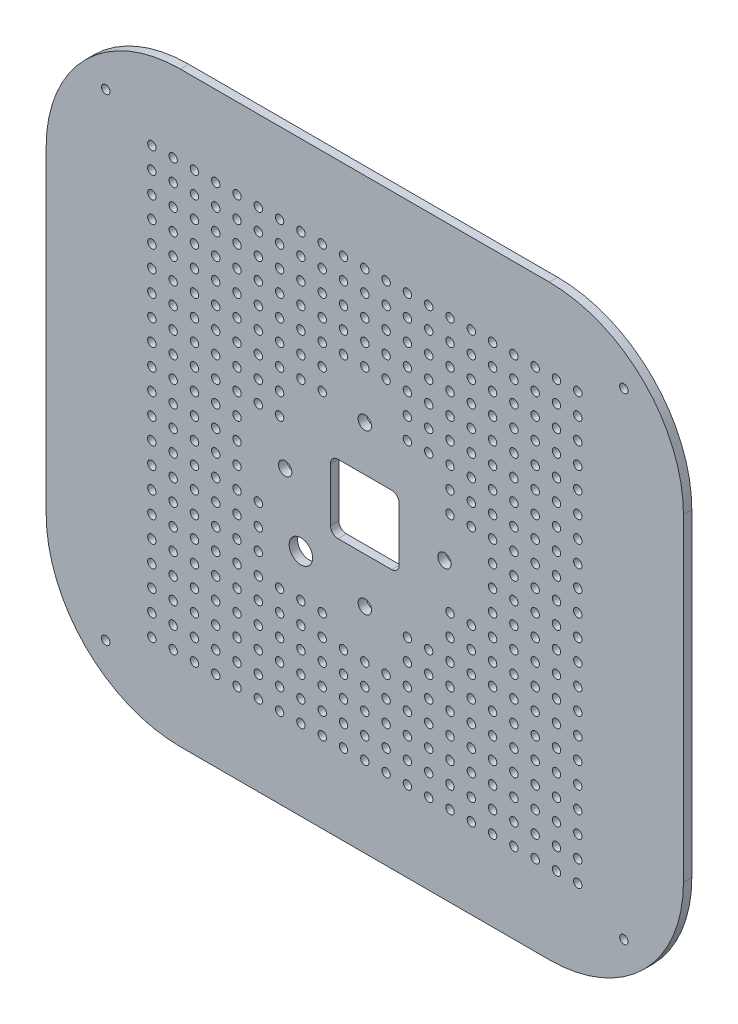
from build123d import *

# Parameters (mm, degrees)
SKETCH_1_R          = 2.5
SKETCH_1_W          = 41
SKETCH_1_H          = 41
EXTRUDE_1_DEPTH     = 5
FILLET_1_R          = 80
FILLET_3_R          = 4.5
SKETCH_2_R          = 2.5
SKETCH_2_R_2        = 4
SKETCH_2_R_3        = 7
CUT_EXTRUDE_1_DEPTH = 10


with BuildPart() as part:
    # 草图1 → 凸台-拉伸1 (new body)
    with BuildSketch(Plane.XY):
        Polygon((190, -61.256325779), (190, 88.743674221), (190, 175), (-190, 175), (-190, 88.743674221), (-190, -61.256325779), (-190, -175), (190, -175), align=None)
        with Locations((154.464472083, 142.269908498)):
            Circle(SKETCH_1_R, mode=Mode.SUBTRACT)
        with Locations((-154.464472083, 142.269908498)):
            Circle(SKETCH_1_R, mode=Mode.SUBTRACT)
        with Locations((-154.464472083, -142.269908498)):
            Circle(SKETCH_1_R, mode=Mode.SUBTRACT)
        with Locations((154.464472083, -142.269908498)):
            Circle(SKETCH_1_R, mode=Mode.SUBTRACT)
        Rectangle(SKETCH_1_W, SKETCH_1_H, mode=Mode.SUBTRACT)
    extrude(amount=EXTRUDE_1_DEPTH)

    # 圆角1
    fillet_1_edges = [part.edges().sort_by_distance(p)[0] for p in [
        (-190, -175, 2.5),
        (190, -175, 2.5),
        (-190, 175, 2.5),
        (190, 175, 2.5),
    ]]
    fillet(fillet_1_edges, radius=FILLET_1_R)

    # 圆角3
    fillet_3_edges = [part.edges().sort_by_distance(p)[0] for p in [
        (-20.5, 20.5, 2.5),
        (20.5, 20.5, 2.5),
        (20.5, -20.5, 2.5),
        (-20.5, -20.5, 2.5),
    ]]
    fillet(fillet_3_edges, radius=FILLET_3_R)

    # 草图2 → 切除-拉伸1 (cut)
    with BuildSketch(Plane.XY.offset(5)):
        with Locations((127, -127)):
            Circle(SKETCH_2_R)
        with Locations((114.3, -127)):
            Circle(SKETCH_2_R)
        with Locations((101.6, -127)):
            Circle(SKETCH_2_R)
        with Locations((88.9, -127)):
            Circle(SKETCH_2_R)
        with Locations((76.2, -127)):
            Circle(SKETCH_2_R)
        with Locations((63.5, -127)):
            Circle(SKETCH_2_R)
        with Locations((50.8, -127)):
            Circle(SKETCH_2_R)
        with Locations((38.1, -127)):
            Circle(SKETCH_2_R)
        with Locations((25.4, -127)):
            Circle(SKETCH_2_R)
        with Locations((12.7, -127)):
            Circle(SKETCH_2_R)
        with Locations((0, -127)):
            Circle(SKETCH_2_R)
        with Locations((-12.7, -127)):
            Circle(SKETCH_2_R)
        with Locations((-25.4, -127)):
            Circle(SKETCH_2_R)
        with Locations((-38.1, -127)):
            Circle(SKETCH_2_R)
        with Locations((-50.8, -127)):
            Circle(SKETCH_2_R)
        with Locations((-63.5, -127)):
            Circle(SKETCH_2_R)
        with Locations((-76.2, -127)):
            Circle(SKETCH_2_R)
        with Locations((-88.9, -127)):
            Circle(SKETCH_2_R)
        with Locations((-101.6, -127)):
            Circle(SKETCH_2_R)
        with Locations((-114.3, -127)):
            Circle(SKETCH_2_R)
        with Locations((114.3, -114.3)):
            Circle(SKETCH_2_R)
        with Locations((101.6, -114.3)):
            Circle(SKETCH_2_R)
        with Locations((88.9, -114.3)):
            Circle(SKETCH_2_R)
        with Locations((76.2, -114.3)):
            Circle(SKETCH_2_R)
        with Locations((63.5, -114.3)):
            Circle(SKETCH_2_R)
        with Locations((50.8, -114.3)):
            Circle(SKETCH_2_R)
        with Locations((38.1, -114.3)):
            Circle(SKETCH_2_R)
        with Locations((25.4, -114.3)):
            Circle(SKETCH_2_R)
        with Locations((12.7, -114.3)):
            Circle(SKETCH_2_R)
        with Locations((0, -114.3)):
            Circle(SKETCH_2_R)
        with Locations((-12.7, -114.3)):
            Circle(SKETCH_2_R)
        with Locations((-25.4, -114.3)):
            Circle(SKETCH_2_R)
        with Locations((-38.1, -114.3)):
            Circle(SKETCH_2_R)
        with Locations((-50.8, -114.3)):
            Circle(SKETCH_2_R)
        with Locations((-63.5, -114.3)):
            Circle(SKETCH_2_R)
        with Locations((-76.2, -114.3)):
            Circle(SKETCH_2_R)
        with Locations((-88.9, -114.3)):
            Circle(SKETCH_2_R)
        with Locations((-101.6, -114.3)):
            Circle(SKETCH_2_R)
        with Locations((-114.3, -114.3)):
            Circle(SKETCH_2_R)
        with Locations((114.3, -101.6)):
            Circle(SKETCH_2_R)
        with Locations((101.6, -101.6)):
            Circle(SKETCH_2_R)
        with Locations((88.9, -101.6)):
            Circle(SKETCH_2_R)
        with Locations((76.2, -101.6)):
            Circle(SKETCH_2_R)
        with Locations((63.5, -101.6)):
            Circle(SKETCH_2_R)
        with Locations((50.8, -101.6)):
            Circle(SKETCH_2_R)
        with Locations((38.1, -101.6)):
            Circle(SKETCH_2_R)
        with Locations((25.4, -101.6)):
            Circle(SKETCH_2_R)
        with Locations((12.7, -101.6)):
            Circle(SKETCH_2_R)
        with Locations((0, -101.6)):
            Circle(SKETCH_2_R)
        with Locations((-12.7, -101.6)):
            Circle(SKETCH_2_R)
        with Locations((-25.4, -101.6)):
            Circle(SKETCH_2_R)
        with Locations((-38.1, -101.6)):
            Circle(SKETCH_2_R)
        with Locations((-50.8, -101.6)):
            Circle(SKETCH_2_R)
        with Locations((-63.5, -101.6)):
            Circle(SKETCH_2_R)
        with Locations((-76.2, -101.6)):
            Circle(SKETCH_2_R)
        with Locations((-88.9, -101.6)):
            Circle(SKETCH_2_R)
        with Locations((-101.6, -101.6)):
            Circle(SKETCH_2_R)
        with Locations((-114.3, -101.6)):
            Circle(SKETCH_2_R)
        with Locations((114.3, -88.9)):
            Circle(SKETCH_2_R)
        with Locations((101.6, -88.9)):
            Circle(SKETCH_2_R)
        with Locations((88.9, -88.9)):
            Circle(SKETCH_2_R)
        with Locations((76.2, -88.9)):
            Circle(SKETCH_2_R)
        with Locations((63.5, -88.9)):
            Circle(SKETCH_2_R)
        with Locations((50.8, -88.9)):
            Circle(SKETCH_2_R)
        with Locations((38.1, -88.9)):
            Circle(SKETCH_2_R)
        with Locations((25.4, -88.9)):
            Circle(SKETCH_2_R)
        with Locations((12.7, -88.9)):
            Circle(SKETCH_2_R)
        with Locations((0, -88.9)):
            Circle(SKETCH_2_R)
        with Locations((-12.7, -88.9)):
            Circle(SKETCH_2_R)
        with Locations((-25.4, -88.9)):
            Circle(SKETCH_2_R)
        with Locations((-38.1, -88.9)):
            Circle(SKETCH_2_R)
        with Locations((-50.8, -88.9)):
            Circle(SKETCH_2_R)
        with Locations((-63.5, -88.9)):
            Circle(SKETCH_2_R)
        with Locations((-76.2, -88.9)):
            Circle(SKETCH_2_R)
        with Locations((-88.9, -88.9)):
            Circle(SKETCH_2_R)
        with Locations((-101.6, -88.9)):
            Circle(SKETCH_2_R)
        with Locations((-114.3, -88.9)):
            Circle(SKETCH_2_R)
        with Locations((114.3, -76.2)):
            Circle(SKETCH_2_R)
        with Locations((101.6, -76.2)):
            Circle(SKETCH_2_R)
        with Locations((88.9, -76.2)):
            Circle(SKETCH_2_R)
        with Locations((76.2, -76.2)):
            Circle(SKETCH_2_R)
        with Locations((63.5, -76.2)):
            Circle(SKETCH_2_R)
        with Locations((50.8, -76.2)):
            Circle(SKETCH_2_R)
        with Locations((38.1, -76.2)):
            Circle(SKETCH_2_R)
        with Locations((25.4, -76.2)):
            Circle(SKETCH_2_R)
        with Locations((12.7, -76.2)):
            Circle(SKETCH_2_R)
        with Locations((0, -76.2)):
            Circle(SKETCH_2_R)
        with Locations((-12.7, -76.2)):
            Circle(SKETCH_2_R)
        with Locations((-25.4, -76.2)):
            Circle(SKETCH_2_R)
        with Locations((-38.1, -76.2)):
            Circle(SKETCH_2_R)
        with Locations((-50.8, -76.2)):
            Circle(SKETCH_2_R)
        with Locations((-63.5, -76.2)):
            Circle(SKETCH_2_R)
        with Locations((-76.2, -76.2)):
            Circle(SKETCH_2_R)
        with Locations((-88.9, -76.2)):
            Circle(SKETCH_2_R)
        with Locations((-101.6, -76.2)):
            Circle(SKETCH_2_R)
        with Locations((-114.3, -76.2)):
            Circle(SKETCH_2_R)
        with Locations((114.3, -63.5)):
            Circle(SKETCH_2_R)
        with Locations((101.6, -63.5)):
            Circle(SKETCH_2_R)
        with Locations((88.9, -63.5)):
            Circle(SKETCH_2_R)
        with Locations((76.2, -63.5)):
            Circle(SKETCH_2_R)
        with Locations((63.5, -63.5)):
            Circle(SKETCH_2_R)
        with Locations((50.8, -63.5)):
            Circle(SKETCH_2_R)
        with Locations((38.1, -63.5)):
            Circle(SKETCH_2_R)
        with Locations((25.4, -63.5)):
            Circle(SKETCH_2_R)
        with Locations((-25.4, -63.5)):
            Circle(SKETCH_2_R)
        with Locations((-38.1, -63.5)):
            Circle(SKETCH_2_R)
        with Locations((-50.8, -63.5)):
            Circle(SKETCH_2_R)
        with Locations((-63.5, -63.5)):
            Circle(SKETCH_2_R)
        with Locations((-76.2, -63.5)):
            Circle(SKETCH_2_R)
        with Locations((-88.9, -63.5)):
            Circle(SKETCH_2_R)
        with Locations((-101.6, -63.5)):
            Circle(SKETCH_2_R)
        with Locations((-114.3, -63.5)):
            Circle(SKETCH_2_R)
        with Locations((114.3, -50.8)):
            Circle(SKETCH_2_R)
        with Locations((101.6, -50.8)):
            Circle(SKETCH_2_R)
        with Locations((88.9, -50.8)):
            Circle(SKETCH_2_R)
        with Locations((76.2, -50.8)):
            Circle(SKETCH_2_R)
        with Locations((63.5, -50.8)):
            Circle(SKETCH_2_R)
        with Locations((50.8, -50.8)):
            Circle(SKETCH_2_R)
        with Locations((38.1, -50.8)):
            Circle(SKETCH_2_R)
        with Locations((25.4, -50.8)):
            Circle(SKETCH_2_R)
        with Locations((-63.5, -50.8)):
            Circle(SKETCH_2_R)
        with Locations((-76.2, -50.8)):
            Circle(SKETCH_2_R)
        with Locations((-88.9, -50.8)):
            Circle(SKETCH_2_R)
        with Locations((-101.6, -50.8)):
            Circle(SKETCH_2_R)
        with Locations((-114.3, -50.8)):
            Circle(SKETCH_2_R)
        with Locations((114.3, -38.1)):
            Circle(SKETCH_2_R)
        with Locations((101.6, -38.1)):
            Circle(SKETCH_2_R)
        with Locations((88.9, -38.1)):
            Circle(SKETCH_2_R)
        with Locations((76.2, -38.1)):
            Circle(SKETCH_2_R)
        with Locations((63.5, -38.1)):
            Circle(SKETCH_2_R)
        with Locations((50.8, -38.1)):
            Circle(SKETCH_2_R)
        with Locations((-63.5, -38.1)):
            Circle(SKETCH_2_R)
        with Locations((-76.2, -38.1)):
            Circle(SKETCH_2_R)
        with Locations((-88.9, -38.1)):
            Circle(SKETCH_2_R)
        with Locations((-101.6, -38.1)):
            Circle(SKETCH_2_R)
        with Locations((-114.3, -38.1)):
            Circle(SKETCH_2_R)
        with Locations((114.3, -25.4)):
            Circle(SKETCH_2_R)
        with Locations((101.6, -25.4)):
            Circle(SKETCH_2_R)
        with Locations((88.9, -25.4)):
            Circle(SKETCH_2_R)
        with Locations((76.2, -25.4)):
            Circle(SKETCH_2_R)
        with Locations((63.5, -25.4)):
            Circle(SKETCH_2_R)
        with Locations((50.8, -25.4)):
            Circle(SKETCH_2_R)
        with Locations((-63.5, -25.4)):
            Circle(SKETCH_2_R)
        with Locations((-76.2, -25.4)):
            Circle(SKETCH_2_R)
        with Locations((-88.9, -25.4)):
            Circle(SKETCH_2_R)
        with Locations((-101.6, -25.4)):
            Circle(SKETCH_2_R)
        with Locations((-114.3, -25.4)):
            Circle(SKETCH_2_R)
        with Locations((114.3, -12.7)):
            Circle(SKETCH_2_R)
        with Locations((101.6, -12.7)):
            Circle(SKETCH_2_R)
        with Locations((88.9, -12.7)):
            Circle(SKETCH_2_R)
        with Locations((76.2, -12.7)):
            Circle(SKETCH_2_R)
        with Locations((-76.2, -12.7)):
            Circle(SKETCH_2_R)
        with Locations((-88.9, -12.7)):
            Circle(SKETCH_2_R)
        with Locations((-101.6, -12.7)):
            Circle(SKETCH_2_R)
        with Locations((-114.3, -12.7)):
            Circle(SKETCH_2_R)
        with Locations((114.3, 0)):
            Circle(SKETCH_2_R)
        with Locations((101.6, 0)):
            Circle(SKETCH_2_R)
        with Locations((88.9, 0)):
            Circle(SKETCH_2_R)
        with Locations((76.2, 0)):
            Circle(SKETCH_2_R)
        with Locations((-76.2, 0)):
            Circle(SKETCH_2_R)
        with Locations((-88.9, 0)):
            Circle(SKETCH_2_R)
        with Locations((-101.6, 0)):
            Circle(SKETCH_2_R)
        with Locations((-114.3, 0)):
            Circle(SKETCH_2_R)
        with Locations((114.3, 12.7)):
            Circle(SKETCH_2_R)
        with Locations((101.6, 12.7)):
            Circle(SKETCH_2_R)
        with Locations((88.9, 12.7)):
            Circle(SKETCH_2_R)
        with Locations((76.2, 12.7)):
            Circle(SKETCH_2_R)
        with Locations((-76.2, 12.7)):
            Circle(SKETCH_2_R)
        with Locations((-88.9, 12.7)):
            Circle(SKETCH_2_R)
        with Locations((-101.6, 12.7)):
            Circle(SKETCH_2_R)
        with Locations((-114.3, 12.7)):
            Circle(SKETCH_2_R)
        with Locations((114.3, 25.4)):
            Circle(SKETCH_2_R)
        with Locations((101.6, 25.4)):
            Circle(SKETCH_2_R)
        with Locations((88.9, 25.4)):
            Circle(SKETCH_2_R)
        with Locations((76.2, 25.4)):
            Circle(SKETCH_2_R)
        with Locations((63.5, 25.4)):
            Circle(SKETCH_2_R)
        with Locations((50.8, 25.4)):
            Circle(SKETCH_2_R)
        with Locations((-50.8, 25.4)):
            Circle(SKETCH_2_R)
        with Locations((-63.5, 25.4)):
            Circle(SKETCH_2_R)
        with Locations((-76.2, 25.4)):
            Circle(SKETCH_2_R)
        with Locations((-88.9, 25.4)):
            Circle(SKETCH_2_R)
        with Locations((-101.6, 25.4)):
            Circle(SKETCH_2_R)
        with Locations((-114.3, 25.4)):
            Circle(SKETCH_2_R)
        with Locations((114.3, 38.1)):
            Circle(SKETCH_2_R)
        with Locations((101.6, 38.1)):
            Circle(SKETCH_2_R)
        with Locations((88.9, 38.1)):
            Circle(SKETCH_2_R)
        with Locations((76.2, 38.1)):
            Circle(SKETCH_2_R)
        with Locations((63.5, 38.1)):
            Circle(SKETCH_2_R)
        with Locations((50.8, 38.1)):
            Circle(SKETCH_2_R)
        with Locations((-50.8, 38.1)):
            Circle(SKETCH_2_R)
        with Locations((-63.5, 38.1)):
            Circle(SKETCH_2_R)
        with Locations((-76.2, 38.1)):
            Circle(SKETCH_2_R)
        with Locations((-88.9, 38.1)):
            Circle(SKETCH_2_R)
        with Locations((-101.6, 38.1)):
            Circle(SKETCH_2_R)
        with Locations((-114.3, 38.1)):
            Circle(SKETCH_2_R)
        with Locations((114.3, 50.8)):
            Circle(SKETCH_2_R)
        with Locations((101.6, 50.8)):
            Circle(SKETCH_2_R)
        with Locations((88.9, 50.8)):
            Circle(SKETCH_2_R)
        with Locations((76.2, 50.8)):
            Circle(SKETCH_2_R)
        with Locations((63.5, 50.8)):
            Circle(SKETCH_2_R)
        with Locations((50.8, 50.8)):
            Circle(SKETCH_2_R)
        with Locations((38.1, 50.8)):
            Circle(SKETCH_2_R)
        with Locations((25.4, 50.8)):
            Circle(SKETCH_2_R)
        with Locations((-25.4, 50.8)):
            Circle(SKETCH_2_R)
        with Locations((-38.1, 50.8)):
            Circle(SKETCH_2_R)
        with Locations((-50.8, 50.8)):
            Circle(SKETCH_2_R)
        with Locations((-63.5, 50.8)):
            Circle(SKETCH_2_R)
        with Locations((-76.2, 50.8)):
            Circle(SKETCH_2_R)
        with Locations((-88.9, 50.8)):
            Circle(SKETCH_2_R)
        with Locations((-101.6, 50.8)):
            Circle(SKETCH_2_R)
        with Locations((-114.3, 50.8)):
            Circle(SKETCH_2_R)
        with Locations((114.3, 63.5)):
            Circle(SKETCH_2_R)
        with Locations((101.6, 63.5)):
            Circle(SKETCH_2_R)
        with Locations((88.9, 63.5)):
            Circle(SKETCH_2_R)
        with Locations((76.2, 63.5)):
            Circle(SKETCH_2_R)
        with Locations((63.5, 63.5)):
            Circle(SKETCH_2_R)
        with Locations((50.8, 63.5)):
            Circle(SKETCH_2_R)
        with Locations((38.1, 63.5)):
            Circle(SKETCH_2_R)
        with Locations((25.4, 63.5)):
            Circle(SKETCH_2_R)
        with Locations((-25.4, 63.5)):
            Circle(SKETCH_2_R)
        with Locations((-38.1, 63.5)):
            Circle(SKETCH_2_R)
        with Locations((-50.8, 63.5)):
            Circle(SKETCH_2_R)
        with Locations((-63.5, 63.5)):
            Circle(SKETCH_2_R)
        with Locations((-76.2, 63.5)):
            Circle(SKETCH_2_R)
        with Locations((-88.9, 63.5)):
            Circle(SKETCH_2_R)
        with Locations((-101.6, 63.5)):
            Circle(SKETCH_2_R)
        with Locations((-114.3, 63.5)):
            Circle(SKETCH_2_R)
        with Locations((114.3, 76.2)):
            Circle(SKETCH_2_R)
        with Locations((101.6, 76.2)):
            Circle(SKETCH_2_R)
        with Locations((88.9, 76.2)):
            Circle(SKETCH_2_R)
        with Locations((76.2, 76.2)):
            Circle(SKETCH_2_R)
        with Locations((63.5, 76.2)):
            Circle(SKETCH_2_R)
        with Locations((50.8, 76.2)):
            Circle(SKETCH_2_R)
        with Locations((38.1, 76.2)):
            Circle(SKETCH_2_R)
        with Locations((25.4, 76.2)):
            Circle(SKETCH_2_R)
        with Locations((12.7, 76.2)):
            Circle(SKETCH_2_R)
        with Locations((0, 76.2)):
            Circle(SKETCH_2_R)
        with Locations((-12.7, 76.2)):
            Circle(SKETCH_2_R)
        with Locations((-25.4, 76.2)):
            Circle(SKETCH_2_R)
        with Locations((-38.1, 76.2)):
            Circle(SKETCH_2_R)
        with Locations((-50.8, 76.2)):
            Circle(SKETCH_2_R)
        with Locations((-63.5, 76.2)):
            Circle(SKETCH_2_R)
        with Locations((-76.2, 76.2)):
            Circle(SKETCH_2_R)
        with Locations((-88.9, 76.2)):
            Circle(SKETCH_2_R)
        with Locations((-101.6, 76.2)):
            Circle(SKETCH_2_R)
        with Locations((-114.3, 76.2)):
            Circle(SKETCH_2_R)
        with Locations((114.3, 88.9)):
            Circle(SKETCH_2_R)
        with Locations((101.6, 88.9)):
            Circle(SKETCH_2_R)
        with Locations((88.9, 88.9)):
            Circle(SKETCH_2_R)
        with Locations((76.2, 88.9)):
            Circle(SKETCH_2_R)
        with Locations((63.5, 88.9)):
            Circle(SKETCH_2_R)
        with Locations((50.8, 88.9)):
            Circle(SKETCH_2_R)
        with Locations((38.1, 88.9)):
            Circle(SKETCH_2_R)
        with Locations((25.4, 88.9)):
            Circle(SKETCH_2_R)
        with Locations((12.7, 88.9)):
            Circle(SKETCH_2_R)
        with Locations((0, 88.9)):
            Circle(SKETCH_2_R)
        with Locations((-12.7, 88.9)):
            Circle(SKETCH_2_R)
        with Locations((-25.4, 88.9)):
            Circle(SKETCH_2_R)
        with Locations((-38.1, 88.9)):
            Circle(SKETCH_2_R)
        with Locations((-50.8, 88.9)):
            Circle(SKETCH_2_R)
        with Locations((-63.5, 88.9)):
            Circle(SKETCH_2_R)
        with Locations((-76.2, 88.9)):
            Circle(SKETCH_2_R)
        with Locations((-88.9, 88.9)):
            Circle(SKETCH_2_R)
        with Locations((-101.6, 88.9)):
            Circle(SKETCH_2_R)
        with Locations((-114.3, 88.9)):
            Circle(SKETCH_2_R)
        with Locations((114.3, 101.6)):
            Circle(SKETCH_2_R)
        with Locations((101.6, 101.6)):
            Circle(SKETCH_2_R)
        with Locations((88.9, 101.6)):
            Circle(SKETCH_2_R)
        with Locations((76.2, 101.6)):
            Circle(SKETCH_2_R)
        with Locations((63.5, 101.6)):
            Circle(SKETCH_2_R)
        with Locations((50.8, 101.6)):
            Circle(SKETCH_2_R)
        with Locations((38.1, 101.6)):
            Circle(SKETCH_2_R)
        with Locations((25.4, 101.6)):
            Circle(SKETCH_2_R)
        with Locations((12.7, 101.6)):
            Circle(SKETCH_2_R)
        with Locations((0, 101.6)):
            Circle(SKETCH_2_R)
        with Locations((-12.7, 101.6)):
            Circle(SKETCH_2_R)
        with Locations((-25.4, 101.6)):
            Circle(SKETCH_2_R)
        with Locations((-38.1, 101.6)):
            Circle(SKETCH_2_R)
        with Locations((-50.8, 101.6)):
            Circle(SKETCH_2_R)
        with Locations((-63.5, 101.6)):
            Circle(SKETCH_2_R)
        with Locations((-76.2, 101.6)):
            Circle(SKETCH_2_R)
        with Locations((-88.9, 101.6)):
            Circle(SKETCH_2_R)
        with Locations((-101.6, 101.6)):
            Circle(SKETCH_2_R)
        with Locations((-114.3, 101.6)):
            Circle(SKETCH_2_R)
        with Locations((114.3, 114.3)):
            Circle(SKETCH_2_R)
        with Locations((101.6, 114.3)):
            Circle(SKETCH_2_R)
        with Locations((88.9, 114.3)):
            Circle(SKETCH_2_R)
        with Locations((76.2, 114.3)):
            Circle(SKETCH_2_R)
        with Locations((63.5, 114.3)):
            Circle(SKETCH_2_R)
        with Locations((50.8, 114.3)):
            Circle(SKETCH_2_R)
        with Locations((38.1, 114.3)):
            Circle(SKETCH_2_R)
        with Locations((25.4, 114.3)):
            Circle(SKETCH_2_R)
        with Locations((12.7, 114.3)):
            Circle(SKETCH_2_R)
        with Locations((0, 114.3)):
            Circle(SKETCH_2_R)
        with Locations((-12.7, 114.3)):
            Circle(SKETCH_2_R)
        with Locations((-25.4, 114.3)):
            Circle(SKETCH_2_R)
        with Locations((-38.1, 114.3)):
            Circle(SKETCH_2_R)
        with Locations((-50.8, 114.3)):
            Circle(SKETCH_2_R)
        with Locations((-63.5, 114.3)):
            Circle(SKETCH_2_R)
        with Locations((-76.2, 114.3)):
            Circle(SKETCH_2_R)
        with Locations((-88.9, 114.3)):
            Circle(SKETCH_2_R)
        with Locations((-101.6, 114.3)):
            Circle(SKETCH_2_R)
        with Locations((-114.3, 114.3)):
            Circle(SKETCH_2_R)
        with Locations((127, -114.3)):
            Circle(SKETCH_2_R)
        with Locations((127, -101.6)):
            Circle(SKETCH_2_R)
        with Locations((127, -88.9)):
            Circle(SKETCH_2_R)
        with Locations((127, -76.2)):
            Circle(SKETCH_2_R)
        with Locations((127, -63.5)):
            Circle(SKETCH_2_R)
        with Locations((127, -50.8)):
            Circle(SKETCH_2_R)
        with Locations((127, -38.1)):
            Circle(SKETCH_2_R)
        with Locations((127, -25.4)):
            Circle(SKETCH_2_R)
        with Locations((127, -12.7)):
            Circle(SKETCH_2_R)
        with Locations((127, 0)):
            Circle(SKETCH_2_R)
        with Locations((127, 12.7)):
            Circle(SKETCH_2_R)
        with Locations((127, 25.4)):
            Circle(SKETCH_2_R)
        with Locations((127, 38.1)):
            Circle(SKETCH_2_R)
        with Locations((127, 50.8)):
            Circle(SKETCH_2_R)
        with Locations((127, 63.5)):
            Circle(SKETCH_2_R)
        with Locations((127, 76.2)):
            Circle(SKETCH_2_R)
        with Locations((127, 88.9)):
            Circle(SKETCH_2_R)
        with Locations((127, 101.6)):
            Circle(SKETCH_2_R)
        with Locations((127, 114.3)):
            Circle(SKETCH_2_R)
        with Locations((127, 127)):
            Circle(SKETCH_2_R)
        with Locations((114.3, 127)):
            Circle(SKETCH_2_R)
        with Locations((101.6, 127)):
            Circle(SKETCH_2_R)
        with Locations((88.9, 127)):
            Circle(SKETCH_2_R)
        with Locations((76.2, 127)):
            Circle(SKETCH_2_R)
        with Locations((63.5, 127)):
            Circle(SKETCH_2_R)
        with Locations((50.8, 127)):
            Circle(SKETCH_2_R)
        with Locations((38.1, 127)):
            Circle(SKETCH_2_R)
        with Locations((25.4, 127)):
            Circle(SKETCH_2_R)
        with Locations((12.7, 127)):
            Circle(SKETCH_2_R)
        with Locations((0, 127)):
            Circle(SKETCH_2_R)
        with Locations((-12.7, 127)):
            Circle(SKETCH_2_R)
        with Locations((-25.4, 127)):
            Circle(SKETCH_2_R)
        with Locations((-38.1, 127)):
            Circle(SKETCH_2_R)
        with Locations((-50.8, 127)):
            Circle(SKETCH_2_R)
        with Locations((-63.5, 127)):
            Circle(SKETCH_2_R)
        with Locations((-76.2, 127)):
            Circle(SKETCH_2_R)
        with Locations((-88.9, 127)):
            Circle(SKETCH_2_R)
        with Locations((-101.6, 127)):
            Circle(SKETCH_2_R)
        with Locations((-114.3, 127)):
            Circle(SKETCH_2_R)
        with Locations((-127, -127)):
            Circle(SKETCH_2_R)
        with Locations((-127, -114.3)):
            Circle(SKETCH_2_R)
        with Locations((-127, -101.6)):
            Circle(SKETCH_2_R)
        with Locations((-127, -88.9)):
            Circle(SKETCH_2_R)
        with Locations((-127, -76.2)):
            Circle(SKETCH_2_R)
        with Locations((-127, -63.5)):
            Circle(SKETCH_2_R)
        with Locations((-127, -50.8)):
            Circle(SKETCH_2_R)
        with Locations((-127, -38.1)):
            Circle(SKETCH_2_R)
        with Locations((-127, -25.4)):
            Circle(SKETCH_2_R)
        with Locations((-127, -12.7)):
            Circle(SKETCH_2_R)
        with Locations((-127, 0)):
            Circle(SKETCH_2_R)
        with Locations((-127, 12.7)):
            Circle(SKETCH_2_R)
        with Locations((-127, 25.4)):
            Circle(SKETCH_2_R)
        with Locations((-127, 38.1)):
            Circle(SKETCH_2_R)
        with Locations((-127, 50.8)):
            Circle(SKETCH_2_R)
        with Locations((-127, 63.5)):
            Circle(SKETCH_2_R)
        with Locations((-127, 76.2)):
            Circle(SKETCH_2_R)
        with Locations((-127, 88.9)):
            Circle(SKETCH_2_R)
        with Locations((-127, 101.6)):
            Circle(SKETCH_2_R)
        with Locations((-127, 114.3)):
            Circle(SKETCH_2_R)
        with Locations((-127, 127)):
            Circle(SKETCH_2_R)
        with Locations((0, -47.5)):
            Circle(SKETCH_2_R_2)
        with Locations((-47.5, 0)):
            Circle(SKETCH_2_R_2)
        with Locations((0, 47.5)):
            Circle(SKETCH_2_R_2)
        with Locations((47.5, 0)):
            Circle(SKETCH_2_R_2)
        with Locations((-38.1, -38.1)):
            Circle(SKETCH_2_R_3)
    extrude(amount=-CUT_EXTRUDE_1_DEPTH, mode=Mode.SUBTRACT)


solid = part.part
